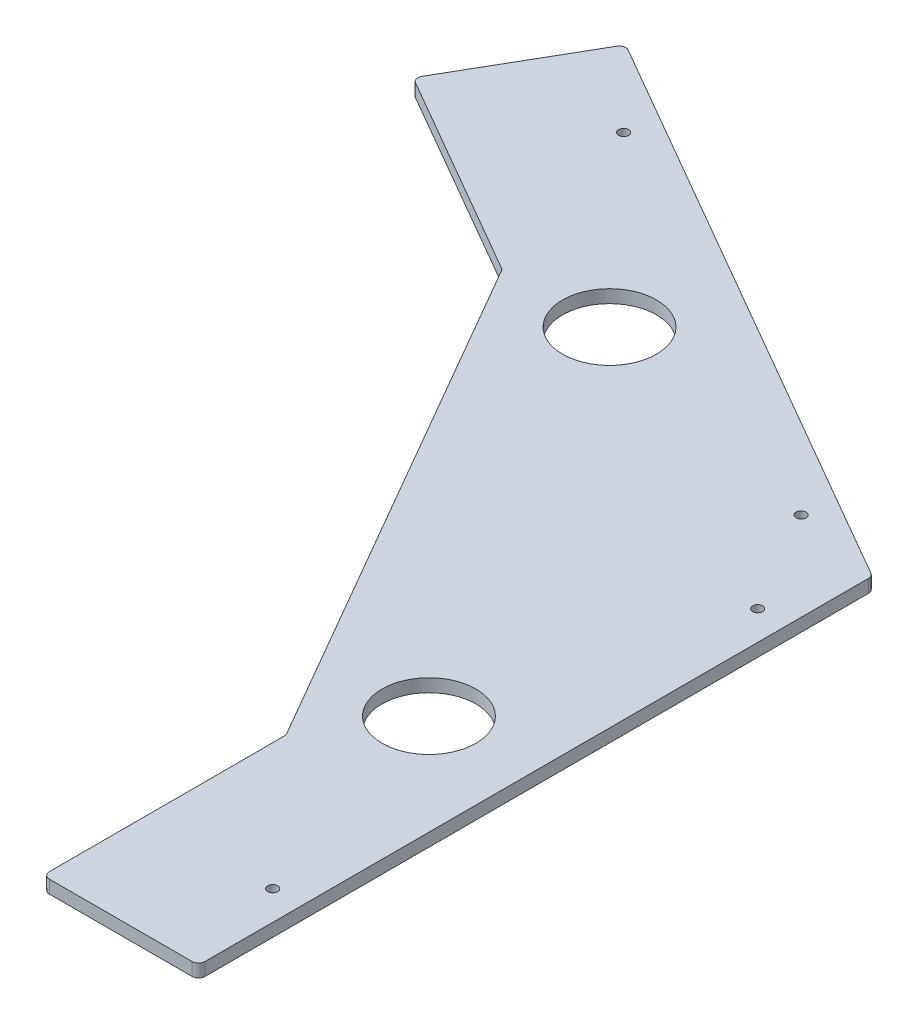
from build123d import *

# Parameters (mm, degrees)
SKETCH1_R           = 23.01875
SKETCH1_R_2         = 2.45745
BOSS_EXTRUDE1_DEPTH = 6.35
FILLET1_R           = 3.175


with BuildPart() as part:
    # Sketch1 → Boss-Extrude1 (new body)
    with BuildSketch(Plane(origin=(0, 0, 0), x_dir=(1, 0, 0), z_dir=(0, 1, 0))):
        Polygon((0, 0), (0, 329.955678842), (-285.75, 494.933518263), (-323.85, 428.942382494), (-220.760110958, 369.423407305), (-76.2, 119.037950379), (-76.2, 0), align=None)
        with Locations((-49.2125, 162.06103122)):
            Circle(SKETCH1_R, mode=Mode.SUBTRACT)
        with Locations((-170.00728, 371.283727469)):
            Circle(SKETCH1_R, mode=Mode.SUBTRACT)
        with Locations((-14.2875, 50.607868786)):
            Circle(SKETCH1_R_2, mode=Mode.SUBTRACT)
        with Locations((-14.2875, 288.082628786)):
            Circle(SKETCH1_R_2, mode=Mode.SUBTRACT)
        with Locations((-43.406875082, 338.518865913)):
            Circle(SKETCH1_R_2, mode=Mode.SUBTRACT)
        with Locations((-249.06605, 457.256245913)):
            Circle(SKETCH1_R_2, mode=Mode.SUBTRACT)
    extrude(amount=BOSS_EXTRUDE1_DEPTH)

    # Fillet1
    fillet1_edges = [part.edges().sort_by_distance(p)[0] for p in [
        (-285.75, 3.175, -494.933518263),
        (0, 3.175, -329.955678842),
        (0, 3.175, 0),
        (-76.2, 3.175, -119.037950379),
        (-220.760110958, 3.175, -369.423407305),
        (-323.85, 3.175, -428.942382494),
        (-76.2, 3.175, 0),
    ]]
    fillet(fillet1_edges, radius=FILLET1_R)


solid = part.part
